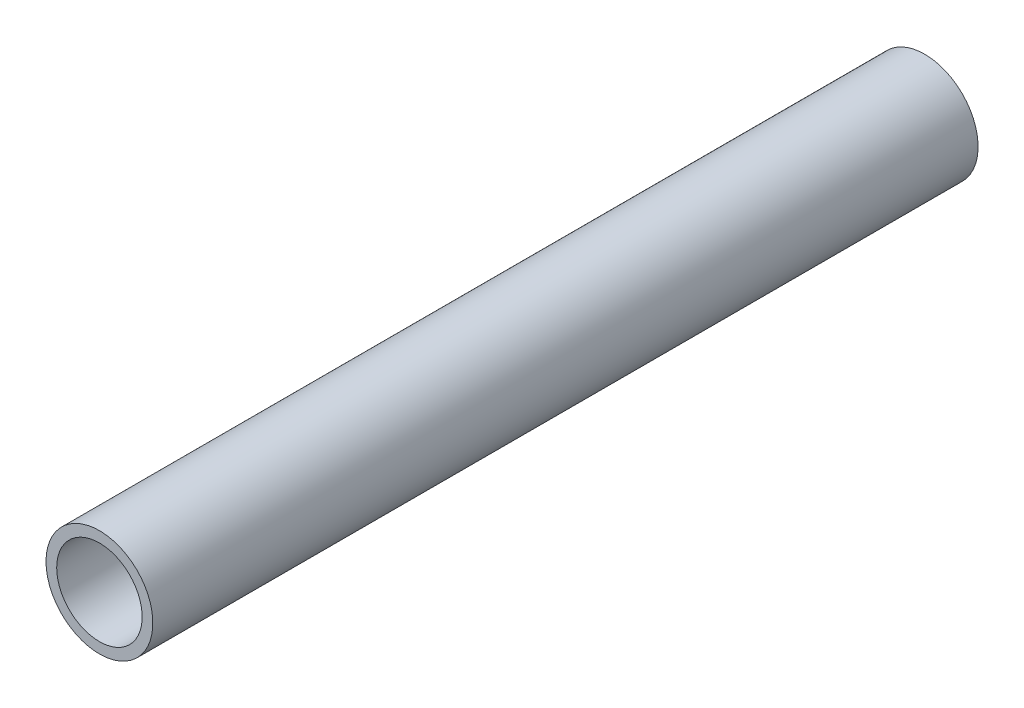
from build123d import *

# Parameters (mm, degrees)
SKETCH1_R           = 1.25
SKETCH1_R_2         = 1
BOSS_EXTRUDE1_DEPTH = 19.31


with BuildPart() as part:
    # Sketch1 → Boss-Extrude1 (new body)
    with BuildSketch(Plane.XY):
        Circle(SKETCH1_R)
        Circle(SKETCH1_R_2, mode=Mode.SUBTRACT)
    extrude(amount=BOSS_EXTRUDE1_DEPTH)


solid = part.part
